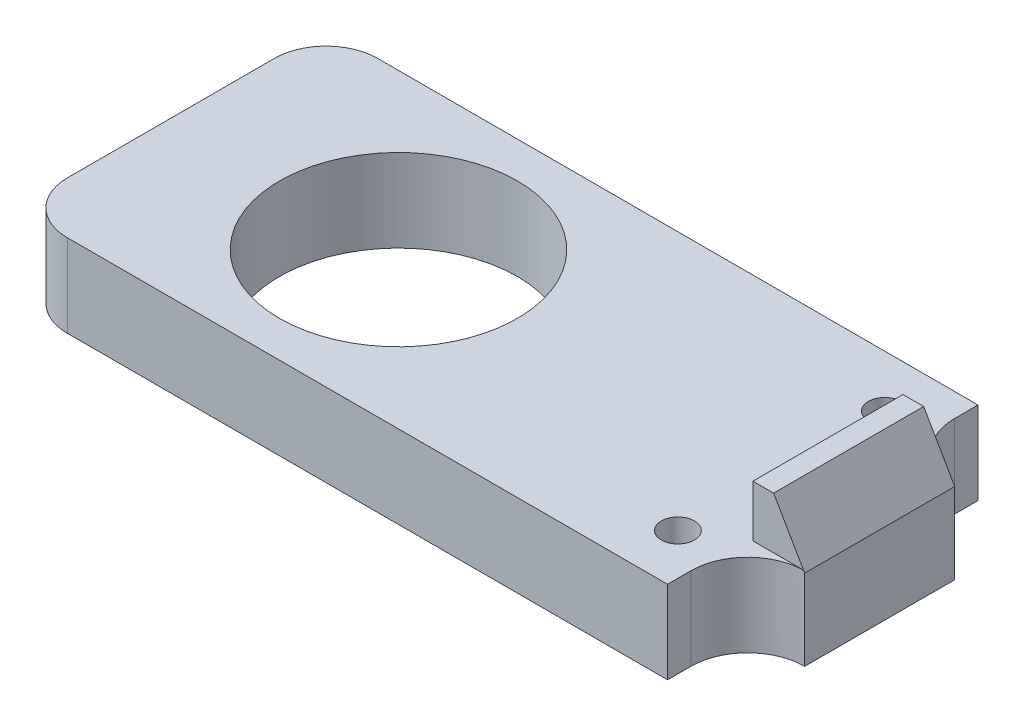
from build123d import *

# Parameters (mm, degrees)
SKETCH1_W           = 63
SKETCH1_H           = 30
SKETCH1_R           = 11.5
BOSS_EXTRUDE1_DEPTH = 5
SKETCH2_R           = 1.6
CUT_EXTRUDE1_DEPTH  = 70.95712973
FILLET1_R           = 5
SKETCH3_W           = 14.5
SKETCH3_H           = 5
BOSS_EXTRUDE2_DEPTH = 0.5
SKETCH4_W           = 14.5
SKETCH4_H           = 10
BOSS_EXTRUDE3_DEPTH = 5
FILLET2_R           = 5.5
SKETCH5_W           = 3.208712153
SKETCH5_H           = 5
CUT_EXTRUDE2_DEPTH  = 76.447001266
CHAMFER1_SIZE       = 5.196152423
CHAMFER1_SIZE_2     = 3
SKETCH6_R           = 1.6
SKETCH6_R_2         = 11.5
BOSS_EXTRUDE4_DEPTH = 3


with BuildPart() as part:
    # Sketch1 → Boss-Extrude1 (new body)
    with BuildSketch(Plane(origin=(0, 0, 0), x_dir=(1, 0, 0), z_dir=(0, 1, 0))):
        with Locations((31.5, 15)):
            Rectangle(SKETCH1_W, SKETCH1_H)
        with Locations(Location((22, 15, 0), (0, 0, 270))):
            Circle(SKETCH1_R, mode=Mode.SUBTRACT)
    extrude(amount=BOSS_EXTRUDE1_DEPTH)

    # Sketch2 → Cut-Extrude1 (cut, through all)
    with BuildSketch(Plane(origin=(0, 5, 0), x_dir=(1, 0, 0), z_dir=(0, 1, 0))):
        with Locations(Location((59, 25, 0), (0, 0, 270))):
            Circle(SKETCH2_R)
        with Locations(Location((59, 5, 0), (0, 0, 270))):
            Circle(SKETCH2_R)
    extrude(amount=-CUT_EXTRUDE1_DEPTH, mode=Mode.SUBTRACT)

    # Fillet1
    fillet1_edges = [part.edges().sort_by_distance(p)[0] for p in [
        (0, 2.5, -30),
        (0, 2.5, 0),
    ]]
    fillet(fillet1_edges, radius=FILLET1_R)

    # Sketch3 → Boss-Extrude2 (add)
    with BuildSketch(Plane(origin=(63, 0, 0), x_dir=(0, 0, -1), z_dir=(1, 0, 0))):
        with Locations((15, 2.5)):
            Rectangle(SKETCH3_W, SKETCH3_H)
    extrude(amount=BOSS_EXTRUDE2_DEPTH)

    # Sketch4 → Boss-Extrude3 (add)
    with BuildSketch(Plane(origin=(63.5, 0, 0), x_dir=(0, 0, -1), z_dir=(1, 0, 0))):
        with Locations((15, 5)):
            Rectangle(SKETCH4_W, SKETCH4_H)
    extrude(amount=BOSS_EXTRUDE3_DEPTH)

    # Fillet2
    # the kernel refuses this fillet: 5.5 mm, written as the material it adds along each edge
    with BuildSketch(Plane(origin=(63, 18.75, -7.75), x_dir=(1, 0, 0), z_dir=(0, -1, 0))) as fillet2_piece_1_section:
        with BuildLine():
            CenterArc((FILLET2_R, FILLET2_R), FILLET2_R, 180, 90)
            Line((0, FILLET2_R), (0, 0))
            Line((0, 0), (FILLET2_R, 0))
        make_face()
    fillet2_piece_1 = extrude(amount=18.75, mode=Mode.PRIVATE)
    fillet2_piece_1 = split(fillet2_piece_1, bisect_by=Plane(origin=(64.81097146, 5, -6.96855226), z_dir=(0, 1, 0)), keep=Keep.TOP, mode=Mode.PRIVATE)
    fillet2_piece_1 = split(fillet2_piece_1, bisect_by=Plane(origin=(64.81097146, 10, -6.96855226), z_dir=(0, -1, 0)), keep=Keep.TOP, mode=Mode.PRIVATE)
    fillet2_piece_1 = split(fillet2_piece_1, bisect_by=Plane(origin=(63.5, 7.5, -6.96855226), z_dir=(1, 0, 0)), keep=Keep.TOP, mode=Mode.PRIVATE)
    add(fillet2_piece_1)
    with BuildSketch(Plane(origin=(63, 5, -7.75), x_dir=(1, 0, 0), z_dir=(0, -1, 0))) as fillet2_piece_2_section:
        with BuildLine():
            CenterArc((FILLET2_R, FILLET2_R), FILLET2_R, 180, 90)
            Line((0, FILLET2_R), (0, 0))
            Line((0, 0), (FILLET2_R, 0))
        make_face()
    fillet2_piece_2 = extrude(amount=5, mode=Mode.PRIVATE)
    fillet2_piece_2 = split(fillet2_piece_2, bisect_by=Plane(origin=(63.5, 2.5, -6.96855226), z_dir=(1, 0, 0)), keep=Keep.TOP, mode=Mode.PRIVATE)
    add(fillet2_piece_2)
    with BuildSketch(Plane(origin=(63, 5, -7.75), x_dir=(1, 0, 0), z_dir=(0, -1, 0))) as fillet2_piece_3_section:
        with BuildLine():
            CenterArc((FILLET2_R, FILLET2_R), FILLET2_R, 180, 90)
            Line((0, FILLET2_R), (0, 0))
            Line((0, 0), (FILLET2_R, 0))
        make_face()
    fillet2_piece_3 = extrude(amount=5, mode=Mode.PRIVATE)
    fillet2_piece_3 = split(fillet2_piece_3, bisect_by=Plane(origin=(63.5, 2.5, -5.619274201), z_dir=(-1, 0, 0)), keep=Keep.TOP, mode=Mode.PRIVATE)
    add(fillet2_piece_3)
    with BuildSketch(Plane(origin=(63, 0, -22.25), x_dir=(0, 0, -1), z_dir=(0, 1, 0))) as fillet2_piece_4_section:
        with BuildLine():
            CenterArc((FILLET2_R, -FILLET2_R), FILLET2_R, 90, 90)
            Line((0, -FILLET2_R), (0, 0))
            Line((0, 0), (FILLET2_R, 0))
        make_face()
    fillet2_piece_4 = extrude(amount=5, mode=Mode.PRIVATE)
    fillet2_piece_4 = split(fillet2_piece_4, bisect_by=Plane(origin=(63.5, 2.5, -24.380725799), z_dir=(-1, 0, 0)), keep=Keep.TOP, mode=Mode.PRIVATE)
    add(fillet2_piece_4)
    with BuildSketch(Plane(origin=(63, 0, -22.25), x_dir=(0, 0, -1), z_dir=(0, 1, 0))) as fillet2_piece_5_section:
        with BuildLine():
            CenterArc((FILLET2_R, -FILLET2_R), FILLET2_R, 90, 90)
            Line((0, -FILLET2_R), (0, 0))
            Line((0, 0), (FILLET2_R, 0))
        make_face()
    fillet2_piece_5 = extrude(amount=5, mode=Mode.PRIVATE)
    fillet2_piece_5 = split(fillet2_piece_5, bisect_by=Plane(origin=(63.5, 2.5, -23.03144774), z_dir=(1, 0, 0)), keep=Keep.TOP, mode=Mode.PRIVATE)
    add(fillet2_piece_5)
    with BuildSketch(Plane(origin=(63, 0, -22.25), x_dir=(0, 0, -1), z_dir=(0, 1, 0))) as fillet2_piece_6_section:
        with BuildLine():
            CenterArc((FILLET2_R, -FILLET2_R), FILLET2_R, 90, 90)
            Line((0, -FILLET2_R), (0, 0))
            Line((0, 0), (FILLET2_R, 0))
        make_face()
    fillet2_piece_6 = extrude(amount=18.75, mode=Mode.PRIVATE)
    fillet2_piece_6 = split(fillet2_piece_6, bisect_by=Plane(origin=(64.81097146, 5, -23.03144774), z_dir=(0, 1, 0)), keep=Keep.TOP, mode=Mode.PRIVATE)
    fillet2_piece_6 = split(fillet2_piece_6, bisect_by=Plane(origin=(64.81097146, 10, -23.03144774), z_dir=(0, -1, 0)), keep=Keep.TOP, mode=Mode.PRIVATE)
    fillet2_piece_6 = split(fillet2_piece_6, bisect_by=Plane(origin=(63.5, 7.5, -23.03144774), z_dir=(1, 0, 0)), keep=Keep.TOP, mode=Mode.PRIVATE)
    add(fillet2_piece_6)

    # Sketch5 → Cut-Extrude2 (cut, through all)
    with BuildSketch(Plane(origin=(68.5, 0, 0), x_dir=(0, 0, -1), z_dir=(1, 0, 0))):
        with Locations((6.145643924, 7.5)):
            Rectangle(SKETCH5_W, SKETCH5_H)
        with Locations((23.854356077, 7.5)):
            Rectangle(SKETCH5_W, SKETCH5_H)
    extrude(amount=-CUT_EXTRUDE2_DEPTH, mode=Mode.SUBTRACT)

    # Chamfer1
    # the kernel refuses this chamfer: 5.196152423, 3 mm, written as the material it takes off along each edge
    with BuildSketch(Plane(origin=(68.5, 10, -35.692891912), x_dir=(0.01932676561270102, -0.9998132206222079, 0), z_dir=(0, 0, 1))) as chamfer1_piece_1:
        Polygon((CHAMFER1_SIZE * 0.999813220566, -CHAMFER1_SIZE * 0.0193267656116), (-CHAMFER1_SIZE_2 * 0.0193267656127, -CHAMFER1_SIZE_2 * 0.999813220622), (0, 0), align=None)
    extrude(amount=41.385783824, mode=Mode.SUBTRACT)

    # Sketch6 → Boss-Extrude4 (add)
    with BuildSketch(Plane.XZ):
        with BuildLine():
            Line((63, -2.25), (63, 0))
            Line((63, 0), (5, 0))
            ThreePointArc((5, 0), (1.464466094, -1.464466094), (0, -5))
            Line((0, -5), (0, -25))
            ThreePointArc((0, -25), (1.464466094, -28.535533906), (5, -30))
            Line((5, -30), (63, -30))
            Line((63, -30), (63, -27.75))
            ThreePointArc((63, -27.75), (64.610912703, -23.860912703), (68.5, -22.25))
            Line((68.5, -22.25), (68.5, -7.75))
            ThreePointArc((68.5, -7.75), (64.610912703, -6.139087297), (63, -2.25))
        make_face()
        with Locations(Location((59, -5, 0), (0, 0, 90))):
            Circle(SKETCH6_R, mode=Mode.SUBTRACT)
        with Locations(Location((22, -15, 0), (0, 0, 270))):
            Circle(SKETCH6_R_2, mode=Mode.SUBTRACT)
        with Locations(Location((59, -25, 0), (0, 0, 90))):
            Circle(SKETCH6_R, mode=Mode.SUBTRACT)
    extrude(amount=BOSS_EXTRUDE4_DEPTH)


solid = part.part
